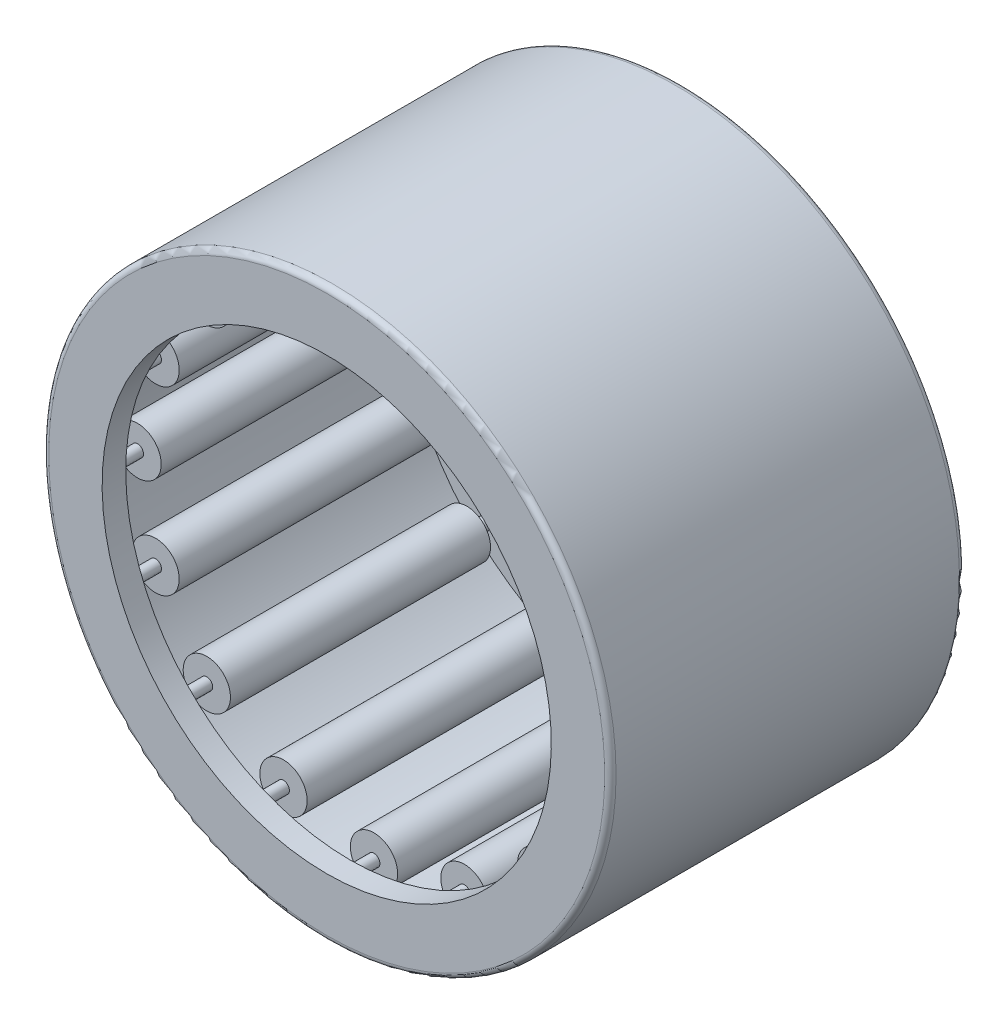
from build123d import *

# Parameters (mm, degrees)
SKETCH2_W         = 11.641666666
SKETCH2_H         = 0.79375
SKETCH3_W         = 13.758333334
SKETCH3_H         = 0.264583334
CIRPATTERN1_COUNT = 16
CIRPATTERN1_ANGLE = 337.5
FILLET1_R         = 0.254


with BuildPart() as part:
    # Sketch1 → Revolve1 (revolve)
    with BuildSketch(Plane(origin=(0, 0, 0), x_dir=(0, 0, -1), z_dir=(1, 0, 0))):
        Polygon((-7.9375, 12.7), (7.9375, 12.7), (7.9375, 10.054166667), (6.879166667, 10.054166667), (6.879166667, 11.641666667), (-6.879166667, 11.641666667), (-6.879166667, 10.054166667), (-7.9375, 10.054166667), align=None)
    revolve(axis=Axis((0, 0, 7.9375), (0, 0, -1)))

    # Fillet1
    fillet1_edges = [part.edges().sort_by_distance(p)[0] for p in [
        (0, -12.7, -7.9375),
        (0, -12.7, 7.9375),
    ]]
    fillet(fillet1_edges, radius=FILLET1_R)


with BuildPart() as body_2:
    # Sketch2 → Revolve2 (revolve)
    with BuildSketch(Plane(origin=(0, 0, 0), x_dir=(0, 0, -1), z_dir=(1, 0, 0))):
        with Locations((0, 11.244791667)):
            Rectangle(SKETCH2_W, SKETCH2_H)
    revolve(axis=Axis((0, 10.583333333, 5.820833333), (0, 0, -1)))


with BuildPart() as body_3:
    # Sketch3 → Revolve3 (revolve)
    with BuildSketch(Plane(origin=(0, 0, 0), x_dir=(0, 0, -1), z_dir=(1, 0, 0))):
        with Locations((0, 10.715625)):
            Rectangle(SKETCH3_W, SKETCH3_H)
    revolve(axis=Axis((0, 10.583333333, 6.879166667), (0, 0, -1)))


with BuildPart() as cirpattern1_1:
    # CirPattern1: pattern copy
    add(body_2.part.rotate(Axis((0, 0, -7.9375), (0, 0, 1)), 1 * CIRPATTERN1_ANGLE / (CIRPATTERN1_COUNT - 1)))


with BuildPart() as cirpattern1_2:
    # CirPattern1: pattern copy
    add(body_2.part.rotate(Axis((0, 0, -7.9375), (0, 0, 1)), 2 * CIRPATTERN1_ANGLE / (CIRPATTERN1_COUNT - 1)))


with BuildPart() as cirpattern1_3:
    # CirPattern1: pattern copy
    add(body_2.part.rotate(Axis((0, 0, -7.9375), (0, 0, 1)), 3 * CIRPATTERN1_ANGLE / (CIRPATTERN1_COUNT - 1)))


with BuildPart() as cirpattern1_4:
    # CirPattern1: pattern copy
    add(body_2.part.rotate(Axis((0, 0, -7.9375), (0, 0, 1)), 4 * CIRPATTERN1_ANGLE / (CIRPATTERN1_COUNT - 1)))


with BuildPart() as cirpattern1_5:
    # CirPattern1: pattern copy
    add(body_2.part.rotate(Axis((0, 0, -7.9375), (0, 0, 1)), 5 * CIRPATTERN1_ANGLE / (CIRPATTERN1_COUNT - 1)))


with BuildPart() as cirpattern1_6:
    # CirPattern1: pattern copy
    add(body_2.part.rotate(Axis((0, 0, -7.9375), (0, 0, 1)), 6 * CIRPATTERN1_ANGLE / (CIRPATTERN1_COUNT - 1)))


with BuildPart() as cirpattern1_7:
    # CirPattern1: pattern copy
    add(body_2.part.rotate(Axis((0, 0, -7.9375), (0, 0, 1)), 7 * CIRPATTERN1_ANGLE / (CIRPATTERN1_COUNT - 1)))


with BuildPart() as cirpattern1_8:
    # CirPattern1: pattern copy
    add(body_2.part.rotate(Axis((0, 0, -7.9375), (0, 0, 1)), 8 * CIRPATTERN1_ANGLE / (CIRPATTERN1_COUNT - 1)))


with BuildPart() as cirpattern1_9:
    # CirPattern1: pattern copy
    add(body_2.part.rotate(Axis((0, 0, -7.9375), (0, 0, 1)), 9 * CIRPATTERN1_ANGLE / (CIRPATTERN1_COUNT - 1)))


with BuildPart() as cirpattern1_10:
    # CirPattern1: pattern copy
    add(body_2.part.rotate(Axis((0, 0, -7.9375), (0, 0, 1)), 10 * CIRPATTERN1_ANGLE / (CIRPATTERN1_COUNT - 1)))


with BuildPart() as cirpattern1_11:
    # CirPattern1: pattern copy
    add(body_2.part.rotate(Axis((0, 0, -7.9375), (0, 0, 1)), 11 * CIRPATTERN1_ANGLE / (CIRPATTERN1_COUNT - 1)))


with BuildPart() as cirpattern1_12:
    # CirPattern1: pattern copy
    add(body_2.part.rotate(Axis((0, 0, -7.9375), (0, 0, 1)), 12 * CIRPATTERN1_ANGLE / (CIRPATTERN1_COUNT - 1)))


with BuildPart() as cirpattern1_13:
    # CirPattern1: pattern copy
    add(body_2.part.rotate(Axis((0, 0, -7.9375), (0, 0, 1)), 13 * CIRPATTERN1_ANGLE / (CIRPATTERN1_COUNT - 1)))


with BuildPart() as cirpattern1_14:
    # CirPattern1: pattern copy
    add(body_2.part.rotate(Axis((0, 0, -7.9375), (0, 0, 1)), 14 * CIRPATTERN1_ANGLE / (CIRPATTERN1_COUNT - 1)))


with BuildPart() as cirpattern1_15:
    # CirPattern1: pattern copy
    add(body_2.part.rotate(Axis((0, 0, -7.9375), (0, 0, 1)), 15 * CIRPATTERN1_ANGLE / (CIRPATTERN1_COUNT - 1)))


with BuildPart() as cirpattern1_16:
    # CirPattern1: pattern copy
    add(body_3.part.rotate(Axis((0, 0, -7.9375), (0, 0, 1)), 1 * CIRPATTERN1_ANGLE / (CIRPATTERN1_COUNT - 1)))


with BuildPart() as cirpattern1_17:
    # CirPattern1: pattern copy
    add(body_3.part.rotate(Axis((0, 0, -7.9375), (0, 0, 1)), 2 * CIRPATTERN1_ANGLE / (CIRPATTERN1_COUNT - 1)))


with BuildPart() as cirpattern1_18:
    # CirPattern1: pattern copy
    add(body_3.part.rotate(Axis((0, 0, -7.9375), (0, 0, 1)), 3 * CIRPATTERN1_ANGLE / (CIRPATTERN1_COUNT - 1)))


with BuildPart() as cirpattern1_19:
    # CirPattern1: pattern copy
    add(body_3.part.rotate(Axis((0, 0, -7.9375), (0, 0, 1)), 4 * CIRPATTERN1_ANGLE / (CIRPATTERN1_COUNT - 1)))


with BuildPart() as cirpattern1_20:
    # CirPattern1: pattern copy
    add(body_3.part.rotate(Axis((0, 0, -7.9375), (0, 0, 1)), 5 * CIRPATTERN1_ANGLE / (CIRPATTERN1_COUNT - 1)))


with BuildPart() as cirpattern1_21:
    # CirPattern1: pattern copy
    add(body_3.part.rotate(Axis((0, 0, -7.9375), (0, 0, 1)), 6 * CIRPATTERN1_ANGLE / (CIRPATTERN1_COUNT - 1)))


with BuildPart() as cirpattern1_22:
    # CirPattern1: pattern copy
    add(body_3.part.rotate(Axis((0, 0, -7.9375), (0, 0, 1)), 7 * CIRPATTERN1_ANGLE / (CIRPATTERN1_COUNT - 1)))


with BuildPart() as cirpattern1_23:
    # CirPattern1: pattern copy
    add(body_3.part.rotate(Axis((0, 0, -7.9375), (0, 0, 1)), 8 * CIRPATTERN1_ANGLE / (CIRPATTERN1_COUNT - 1)))


with BuildPart() as cirpattern1_24:
    # CirPattern1: pattern copy
    add(body_3.part.rotate(Axis((0, 0, -7.9375), (0, 0, 1)), 9 * CIRPATTERN1_ANGLE / (CIRPATTERN1_COUNT - 1)))


with BuildPart() as cirpattern1_25:
    # CirPattern1: pattern copy
    add(body_3.part.rotate(Axis((0, 0, -7.9375), (0, 0, 1)), 10 * CIRPATTERN1_ANGLE / (CIRPATTERN1_COUNT - 1)))


with BuildPart() as cirpattern1_26:
    # CirPattern1: pattern copy
    add(body_3.part.rotate(Axis((0, 0, -7.9375), (0, 0, 1)), 11 * CIRPATTERN1_ANGLE / (CIRPATTERN1_COUNT - 1)))


with BuildPart() as cirpattern1_27:
    # CirPattern1: pattern copy
    add(body_3.part.rotate(Axis((0, 0, -7.9375), (0, 0, 1)), 12 * CIRPATTERN1_ANGLE / (CIRPATTERN1_COUNT - 1)))


with BuildPart() as cirpattern1_28:
    # CirPattern1: pattern copy
    add(body_3.part.rotate(Axis((0, 0, -7.9375), (0, 0, 1)), 13 * CIRPATTERN1_ANGLE / (CIRPATTERN1_COUNT - 1)))


with BuildPart() as cirpattern1_29:
    # CirPattern1: pattern copy
    add(body_3.part.rotate(Axis((0, 0, -7.9375), (0, 0, 1)), 14 * CIRPATTERN1_ANGLE / (CIRPATTERN1_COUNT - 1)))


with BuildPart() as cirpattern1_30:
    # CirPattern1: pattern copy
    add(body_3.part.rotate(Axis((0, 0, -7.9375), (0, 0, 1)), 15 * CIRPATTERN1_ANGLE / (CIRPATTERN1_COUNT - 1)))


solid = Compound([part.part, body_2.part, body_3.part, cirpattern1_1.part, cirpattern1_2.part, cirpattern1_3.part, cirpattern1_4.part, cirpattern1_5.part, cirpattern1_6.part, cirpattern1_7.part, cirpattern1_8.part, cirpattern1_9.part, cirpattern1_10.part, cirpattern1_11.part, cirpattern1_12.part, cirpattern1_13.part, cirpattern1_14.part, cirpattern1_15.part, cirpattern1_16.part, cirpattern1_17.part, cirpattern1_18.part, cirpattern1_19.part, cirpattern1_20.part, cirpattern1_21.part, cirpattern1_22.part, cirpattern1_23.part, cirpattern1_24.part, cirpattern1_25.part, cirpattern1_26.part, cirpattern1_27.part, cirpattern1_28.part, cirpattern1_29.part, cirpattern1_30.part])
